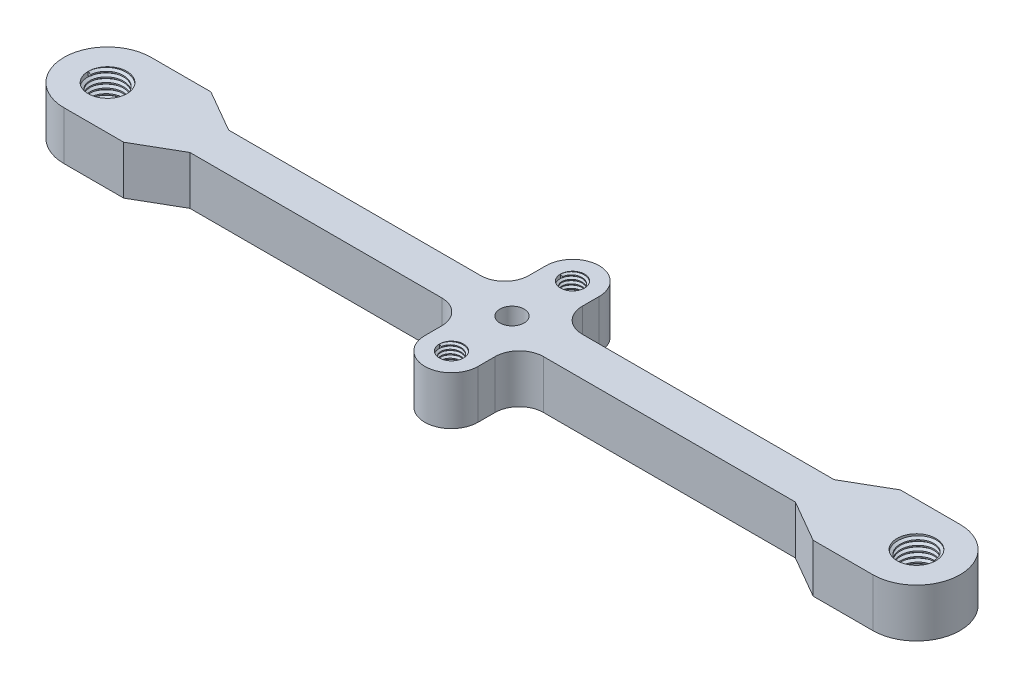
from build123d import *

# Parameters (mm, degrees)
SKETCH1_R           = 2.5
SKETCH1_R_2         = 4
BOSS_EXTRUDE1_DEPTH = 5
THREAD1_PITCH       = 1
THREAD2_PITCH       = 0.8
THREAD3_PITCH       = 0.8


with BuildPart() as part:
    # Sketch1 → Boss-Extrude1 (new, symmetric)
    with BuildSketch(Plane(origin=(0, 0, 0), x_dir=(1, 0, 0), z_dir=(0, 1, 0))):
        with BuildLine():
            Line((-71.160254038, 9), (-83.5, 9))
            ThreePointArc((-83.5, 9), (-92.5, 0), (-83.5, -9))
            Line((-83.5, -9), (-71.160254038, -9))
            Line((-71.160254038, -9), (-62.5, -4))
            Line((-62.5, -4), (-10.5, -4))
            ThreePointArc((-10.5, -4), (-6.964466094, -5.464466094), (-5.5, -9))
            Line((-5.5, -9), (-5.5, -12.5))
            ThreePointArc((-5.5, -12.5), (0, -18), (5.5, -12.5))
            Line((5.5, -12.5), (5.5, -9))
            ThreePointArc((5.5, -9), (6.964466094, -5.464466094), (10.5, -4))
            Line((10.5, -4), (62.5, -4))
            Line((62.5, -4), (71.160254038, -9))
            Line((71.160254038, -9), (83.5, -9))
            ThreePointArc((83.5, -9), (92.5, 0), (83.5, 9))
            Line((83.5, 9), (71.160254038, 9))
            Line((71.160254038, 9), (62.5, 4))
            Line((62.5, 4), (10.493118207, 4))
            ThreePointArc((10.493118207, 4), (6.954105293, 5.467948528), (5.493127899, 9.00984496))
            Line((5.493127899, 9.00984496), (5.499957354, 12.478341129))
            Line((5.499957354, 12.478341129), (5.5, 12.5))
            ThreePointArc((5.5, 12.5), (0, 18), (-5.5, 12.5))
            Line((-5.5, 12.5), (-5.5, 9))
            ThreePointArc((-5.5, 9), (-6.964466094, 5.464466094), (-10.5, 4))
            Line((-10.5, 4), (-62.5, 4))
            Line((-62.5, 4), (-71.160254038, 9))
        make_face()
        with Locations(Location((0, -12.5, 0), (0, 0, 270))):
            Circle(SKETCH1_R, mode=Mode.SUBTRACT)
        with Locations(Location((-83.5, 0, 0), (0, 0, 270))):
            Circle(SKETCH1_R_2, mode=Mode.SUBTRACT)
        with Locations(Location((0, 0, 0), (0, 0, 270))):
            Circle(SKETCH1_R, mode=Mode.SUBTRACT)
        with Locations(Location((83.5, 0, 0), (0, 0, 270))):
            Circle(SKETCH1_R_2, mode=Mode.SUBTRACT)
        with Locations(Location((0, 12.5, 0), (0, 0, 270))):
            Circle(SKETCH1_R, mode=Mode.SUBTRACT)
    extrude(amount=BOSS_EXTRUDE1_DEPTH, both=True)

    # Thread1: the profile of Thread Profile1 profile screwed along a right-hand helix of 10 turns, 8 arcs to a turn; built about Z, then put on its axis
    thread1_z = Axis((0, 0, 0), (0, 0, 1))
    thread1_corners = [(4.0003, 0, -0.000173205), (4.0003, 0, 0.875173202), (3.458734125, 0, 0.562499999), (3.458734125, 0, 0.312499999)]
    with BuildLine(mode=Mode.PRIVATE) as thread1_profile:
        Line(thread1_corners[0], thread1_corners[1])
        Line(thread1_corners[1], thread1_corners[2])
        Line(thread1_corners[2], thread1_corners[3])
        Line(thread1_corners[3], thread1_corners[0])
    thread1_cap = Face(thread1_profile.wire())
    thread1_turn_angles = [0, 22.5, 45, 67.5, 90, 112.5, 135, 157.5, 180, 202.5, 225, 247.5, 270, 292.5, 315, 337.5, 360]
    thread1_turn_weights = [1, 0.9238795325112867, 1, 0.9238795325112867, 1, 0.9238795325112867, 1, 0.9238795325112867, 1, 0.9238795325112867, 1, 0.9238795325112867, 1, 0.9238795325112867, 1, 0.9238795325112867, 1]
    thread1_turn_rails = [Edge.make_bspline([Vector(p[0], p[1], 0).rotate(thread1_z, thread1_turn_angles[k]) / thread1_turn_weights[k] + Vector(0, 0, p[2] + THREAD1_PITCH * thread1_turn_angles[k] / 360) for k in range(17)], [0, 0, 0, 1, 1, 2, 2, 3, 3, 4, 4, 5, 5, 6, 6, 7, 7, 8, 8, 8], 2, thread1_turn_weights) for p in thread1_corners]
    thread1_turn_sides = [Face.make_surface_from_curves(thread1_turn_rails[p[0]], thread1_turn_rails[p[1]]) for p in [(0, 1), (1, 2), (2, 3), (3, 0)]]
    thread1 = Plane(origin=(-83.5, 5, 0), x_dir=(-1, 0, 0), z_dir=(0, -1, 0)) * Solid(Shell([*[p.moved(Location((0, 0, THREAD1_PITCH * i))) for i in range(10) for p in thread1_turn_sides], thread1_cap, thread1_cap.rotate(thread1_z, 3600).moved(Location((0, 0, THREAD1_PITCH * 3600 / 360)))]))
    add(thread1)

    # Thread2: the profile of Thread Profile2 profile screwed along a right-hand helix of 12.5 turns, 8 arcs to a turn; built about Z, then put on its axis
    thread2_z = Axis((0, 0, 0), (0, 0, 1))
    thread2_corners = [(2.5003, 0, -0.000173205), (2.5003, 0, 0.700173203), (2.0669873, 0, 0.449999999), (2.0669873, 0, 0.249999999)]
    with BuildLine(mode=Mode.PRIVATE) as thread2_profile:
        Line(thread2_corners[0], thread2_corners[1])
        Line(thread2_corners[1], thread2_corners[2])
        Line(thread2_corners[2], thread2_corners[3])
        Line(thread2_corners[3], thread2_corners[0])
    thread2_cap = Face(thread2_profile.wire())
    thread2_turn_angles = [0, 22.5, 45, 67.5, 90, 112.5, 135, 157.5, 180, 202.5, 225, 247.5, 270, 292.5, 315, 337.5, 360]
    thread2_turn_weights = [1, 0.9238795325112867, 1, 0.9238795325112867, 1, 0.9238795325112867, 1, 0.9238795325112867, 1, 0.9238795325112867, 1, 0.9238795325112867, 1, 0.9238795325112867, 1, 0.9238795325112867, 1]
    thread2_turn_rails = [Edge.make_bspline([Vector(p[0], p[1], 0).rotate(thread2_z, thread2_turn_angles[k]) / thread2_turn_weights[k] + Vector(0, 0, p[2] + THREAD2_PITCH * thread2_turn_angles[k] / 360) for k in range(17)], [0, 0, 0, 1, 1, 2, 2, 3, 3, 4, 4, 5, 5, 6, 6, 7, 7, 8, 8, 8], 2, thread2_turn_weights) for p in thread2_corners]
    thread2_turn_sides = [Face.make_surface_from_curves(thread2_turn_rails[p[0]], thread2_turn_rails[p[1]]) for p in [(0, 1), (1, 2), (2, 3), (3, 0)]]
    thread2_last_angles = [4320, 4342.5, 4365, 4387.5, 4410, 4432.5, 4455, 4477.5, 4500]
    thread2_last_weights = [1, 0.9238795325112867, 1, 0.9238795325112867, 1, 0.9238795325112867, 1, 0.9238795325112867, 1]
    thread2_last_rails = [Edge.make_bspline([Vector(p[0], p[1], 0).rotate(thread2_z, thread2_last_angles[k]) / thread2_last_weights[k] + Vector(0, 0, p[2] + THREAD2_PITCH * thread2_last_angles[k] / 360) for k in range(9)], [0, 0, 0, 1, 1, 2, 2, 3, 3, 4, 4, 4], 2, thread2_last_weights) for p in thread2_corners]
    thread2_last_sides = [Face.make_surface_from_curves(thread2_last_rails[p[0]], thread2_last_rails[p[1]]) for p in [(0, 1), (1, 2), (2, 3), (3, 0)]]
    thread2 = Plane(origin=(0, 5, 12.5), x_dir=(-1, 0, 0), z_dir=(0, -1, 0)) * Solid(Shell([*[p.moved(Location((0, 0, THREAD2_PITCH * i))) for i in range(12) for p in thread2_turn_sides], *thread2_last_sides, thread2_cap, thread2_cap.rotate(thread2_z, 4500).moved(Location((0, 0, THREAD2_PITCH * 4500 / 360)))]))
    add(thread2)

    # Thread3: the profile of Thread Profile3 profile screwed along a right-hand helix of 12.5 turns, 8 arcs to a turn; built about Z, then put on its axis
    thread3_z = Axis((0, 0, 0), (0, 0, 1))
    thread3_corners = [(2.5003, 0, -0.000173205), (2.5003, 0, 0.700173203), (2.0669873, 0, 0.449999999), (2.0669873, 0, 0.249999999)]
    with BuildLine(mode=Mode.PRIVATE) as thread3_profile:
        Line(thread3_corners[0], thread3_corners[1])
        Line(thread3_corners[1], thread3_corners[2])
        Line(thread3_corners[2], thread3_corners[3])
        Line(thread3_corners[3], thread3_corners[0])
    thread3_cap = Face(thread3_profile.wire())
    thread3_turn_angles = [0, 22.5, 45, 67.5, 90, 112.5, 135, 157.5, 180, 202.5, 225, 247.5, 270, 292.5, 315, 337.5, 360]
    thread3_turn_weights = [1, 0.9238795325112867, 1, 0.9238795325112867, 1, 0.9238795325112867, 1, 0.9238795325112867, 1, 0.9238795325112867, 1, 0.9238795325112867, 1, 0.9238795325112867, 1, 0.9238795325112867, 1]
    thread3_turn_rails = [Edge.make_bspline([Vector(p[0], p[1], 0).rotate(thread3_z, thread3_turn_angles[k]) / thread3_turn_weights[k] + Vector(0, 0, p[2] + THREAD3_PITCH * thread3_turn_angles[k] / 360) for k in range(17)], [0, 0, 0, 1, 1, 2, 2, 3, 3, 4, 4, 5, 5, 6, 6, 7, 7, 8, 8, 8], 2, thread3_turn_weights) for p in thread3_corners]
    thread3_turn_sides = [Face.make_surface_from_curves(thread3_turn_rails[p[0]], thread3_turn_rails[p[1]]) for p in [(0, 1), (1, 2), (2, 3), (3, 0)]]
    thread3_last_angles = [4320, 4342.5, 4365, 4387.5, 4410, 4432.5, 4455, 4477.5, 4500]
    thread3_last_weights = [1, 0.9238795325112867, 1, 0.9238795325112867, 1, 0.9238795325112867, 1, 0.9238795325112867, 1]
    thread3_last_rails = [Edge.make_bspline([Vector(p[0], p[1], 0).rotate(thread3_z, thread3_last_angles[k]) / thread3_last_weights[k] + Vector(0, 0, p[2] + THREAD3_PITCH * thread3_last_angles[k] / 360) for k in range(9)], [0, 0, 0, 1, 1, 2, 2, 3, 3, 4, 4, 4], 2, thread3_last_weights) for p in thread3_corners]
    thread3_last_sides = [Face.make_surface_from_curves(thread3_last_rails[p[0]], thread3_last_rails[p[1]]) for p in [(0, 1), (1, 2), (2, 3), (3, 0)]]
    thread3 = Plane(origin=(0, 5, -12.5), x_dir=(-1, 0, 0), z_dir=(0, -1, 0)) * Solid(Shell([*[p.moved(Location((0, 0, THREAD3_PITCH * i))) for i in range(12) for p in thread3_turn_sides], *thread3_last_sides, thread3_cap, thread3_cap.rotate(thread3_z, 4500).moved(Location((0, 0, THREAD3_PITCH * 4500 / 360)))]))
    add(thread3)

    # Mirror1: Thread1 across plane
    add(thread1.mirror(Plane(origin=(0, 0, 0), x_dir=(0, 0, 1), z_dir=(1, 0, 0))))


solid = part.part
